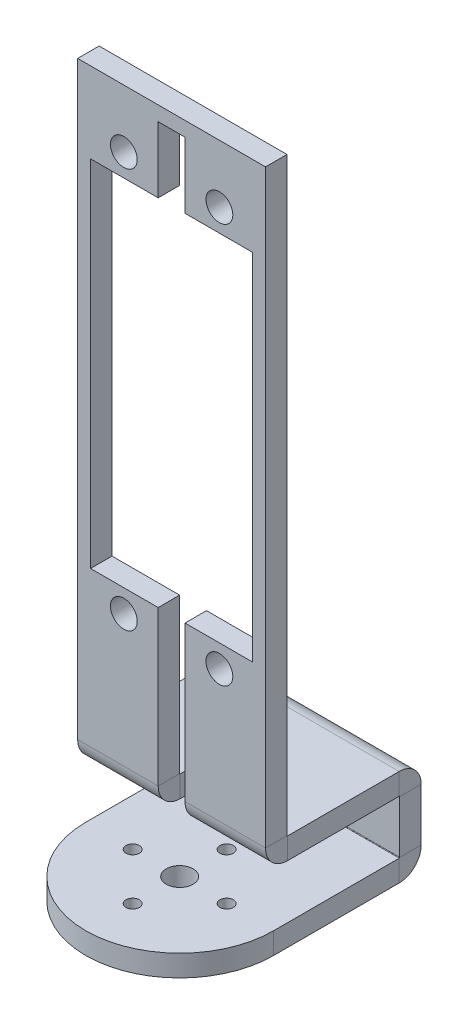
from build123d import *

# Parameters (mm, degrees)
BOSS_EXTRUDE2_DEPTH    = 4
SKETCH4_W              = 35
SKETCH4_H              = 4
BOSS_EXTRUDE3_DEPTH    = 10
BOSS_EXTRUDE4_DEPTH    = 35
SKETCH9_R              = 2.5
CUT_EXTRUDE1_DEPTH     = 6
SKETCH10_R             = 1.25
CUT_EXTRUDE2_DEPTH     = 6
SKETCH11_R             = 2.5
CUT_EXTRUDE3_DEPTH     = 4
CONVERT_SOLID2_START   = -17.5
CONVERT_SOLID2_DEPTH   = 35
CONVERT_SOLID2_2_DEPTH = 35
CONVERT_SOLID2_3_DEPTH = 15
CONVERT_SOLID2_START_2 = 2.5
CONVERT_SOLID2_4_DEPTH = 15


# Read off the part's stored shape, not the designer's step: Convert-Solid2
with BuildPart() as part:
    # Sketch3 → Boss-Extrude2 (new body)
    with BuildSketch(Plane(origin=(0, 0, 0), x_dir=(1, 0, 0), z_dir=(0, 1, 0))):
        with BuildLine():
            Line((-17.5, 0), (-17.5, 27.5))
            Line((-17.5, 27.5), (17.5, 27.5))
            Line((17.5, 27.5), (17.5, 0))
            ThreePointArc((17.5, 0), (0, -17.5), (-17.5, 0))
        make_face()
    extrude(amount=BOSS_EXTRUDE2_DEPTH)

    # Sketch4 → Boss-Extrude3 (add)
    with BuildSketch(Plane(origin=(0, 4, 0), x_dir=(1, 0, 0), z_dir=(0, 1, 0))):
        with Locations((0, 25.5)):
            Rectangle(SKETCH4_W, SKETCH4_H)
    extrude(amount=BOSS_EXTRUDE3_DEPTH)

    # Sketch6 → Boss-Extrude4 (add)
    with BuildSketch(Plane.ZY.offset(17.5)):
        Polygon((-27.5, 14), (-27.5, 18), (-2.5, 18), (-2.5, 128), (1.5, 128), (1.5, 14), align=None)
    extrude(amount=-BOSS_EXTRUDE4_DEPTH)

    # Sketch9 → Cut-Extrude1 (cut)
    with BuildSketch(Plane.XY.offset(1.5)):
        with Locations((-8.9, 117.2)):
            Circle(SKETCH9_R)
        with Locations(Location((8.9, 117.2, 0), (0, 0, 180))):
            Circle(SKETCH9_R)
        with Locations(Location((-8.9, 42.7, 0), (0, 0, 180))):
            Circle(SKETCH9_R)
        with Locations((8.9, 42.7)):
            Circle(SKETCH9_R)
        Polygon((-15.1, 113), (-2.5, 113), (-2.5, 125.287895972), (0, 125.287895972), (2.5, 125.287895972), (2.5, 113), (15.1, 113), (15.1, 46.9), (2.5, 46.9), (2.5, 10), (-2.5, 10), (-2.5, 46.9), (-15.1, 46.9), align=None)
    extrude(amount=-CUT_EXTRUDE1_DEPTH, mode=Mode.SUBTRACT)

    # Sketch10 → Cut-Extrude2 (cut)
    with BuildSketch(Plane.XZ):
        with Locations(Location((-8.75, 0, 0), (0, 0, 270))):
            Circle(SKETCH10_R)
        with Locations(Location((8.75, 0, 0), (0, 0, 90))):
            Circle(SKETCH10_R)
        with Locations(Location((0, 8.75, 0), (0, 0, 270))):
            Circle(SKETCH10_R)
        with Locations(Location((0, -8.75, 0), (0, 0, 270))):
            Circle(SKETCH10_R)
    extrude(amount=-CUT_EXTRUDE2_DEPTH, mode=Mode.SUBTRACT)

    # Sketch11 → Cut-Extrude3 (cut)
    with BuildSketch(Plane.XZ):
        with Locations(Location((0, 0, 0), (0, 0, 270))):
            Circle(SKETCH11_R)
    extrude(amount=-CUT_EXTRUDE3_DEPTH, mode=Mode.SUBTRACT)

    # Convert-Solid2 outline → Convert-Solid2 (cut)
    with BuildSketch(Plane.YZ.offset(CONVERT_SOLID2_START)):
        with BuildLine():
            Line((0, -27.5), (4.1, -27.5))
            ThreePointArc((4.1, -27.5), (1.200862197, -26.299137803), (0, -23.4))
            Line((0, -23.4), (0, -27.5))
        make_face()
        with BuildLine():
            Line((18, -27.5), (18, -23.4))
            ThreePointArc((18, -23.4), (16.799137803, -26.299137803), (13.9, -27.5))
            Line((13.9, -27.5), (18, -27.5))
        make_face()
        with BuildLine():
            ThreePointArc((14, -2.6), (15.200862197, 0.299137803), (18.1, 1.5))
            Line((18.1, 1.5), (14, 1.5))
            Line((14, 1.5), (14, -2.6))
        make_face()
    extrude(amount=CONVERT_SOLID2_DEPTH, mode=Mode.SUBTRACT)

    # Convert-Solid2 2 outline → Convert-Solid2 2 (add)
    with BuildSketch(Plane.YZ.offset(CONVERT_SOLID2_START)):
        with BuildLine():
            Line((4, -23.5), (4.1, -23.5))
            ThreePointArc((4.1, -23.5), (4.029289322, -23.470710678), (4, -23.4))
            Line((4, -23.4), (4, -23.5))
        make_face()
        with BuildLine():
            Line((14, -23.5), (14, -23.4))
            ThreePointArc((14, -23.4), (13.970710678, -23.470710678), (13.9, -23.5))
            Line((13.9, -23.5), (14, -23.5))
        make_face()
    extrude(amount=CONVERT_SOLID2_2_DEPTH)

    # Convert-Solid2 3 outline → Convert-Solid2 3 (add)
    with BuildSketch(Plane.YZ.offset(CONVERT_SOLID2_START)):
        with BuildLine():
            ThreePointArc((18, -2.6), (18.029289322, -2.529289322), (18.1, -2.5))
            Line((18.1, -2.5), (18, -2.5))
            Line((18, -2.5), (18, -2.6))
        make_face()
    extrude(amount=CONVERT_SOLID2_3_DEPTH)

    # Convert-Solid2 4 outline → Convert-Solid2 4 (add)
    with BuildSketch(Plane.YZ.offset(CONVERT_SOLID2_START_2)):
        with BuildLine():
            ThreePointArc((18, -2.6), (18.029289322, -2.529289322), (18.1, -2.5))
            Line((18.1, -2.5), (18, -2.5))
            Line((18, -2.5), (18, -2.6))
        make_face()
    extrude(amount=CONVERT_SOLID2_4_DEPTH)


solid = part.part
